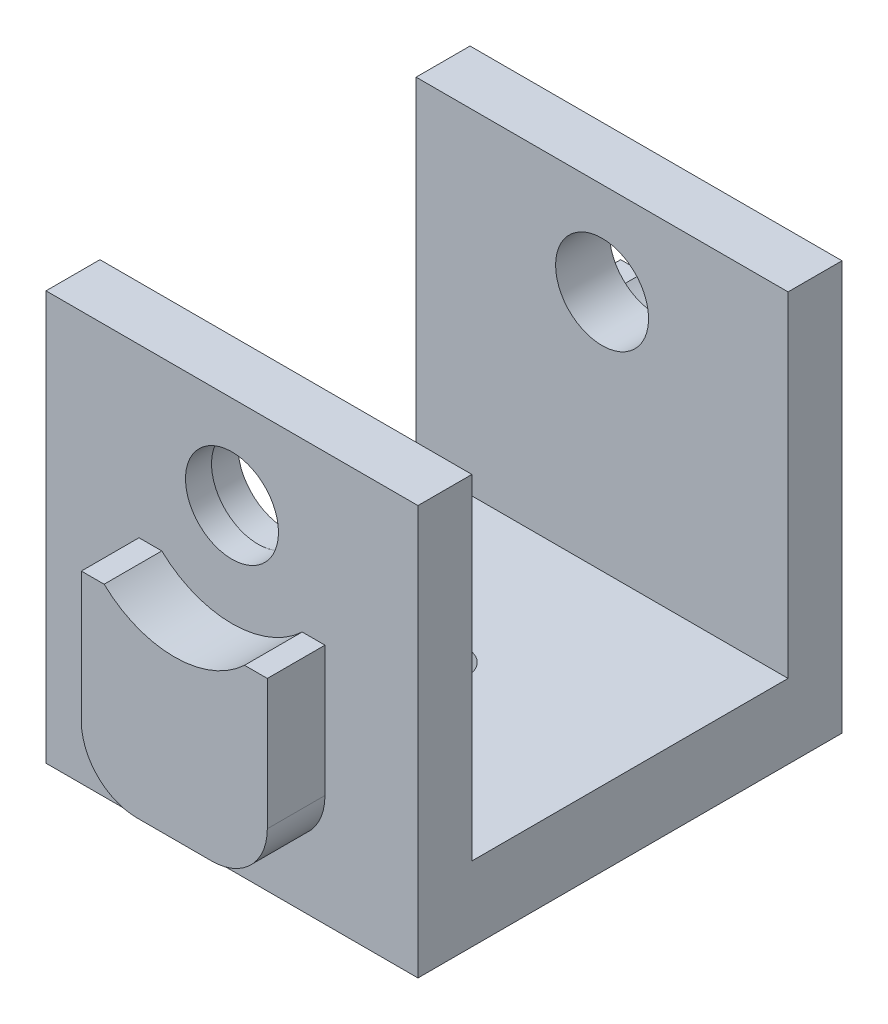
from build123d import *
from build123d.topology import SkipClean

# Parameters (mm, degrees)
SKETCH114_W          = 20
SKETCH114_H          = 22
BOSS_EXTRUDE16_DEPTH = 20
SKETCH115_W          = 17
SKETCH115_H          = 18
CUT_EXTRUDE6_DEPTH   = 48.889560449
BOSS_EXTRUDE17_DEPTH = 3.1
BOSS_EXTRUDE18_DEPTH = 3.1
SKETCH123_W          = 2.5
SKETCH123_H          = 1.501
SKETCH125_W          = 1.2645
SKETCH125_H          = 4
FILLET6_R            = 3
FILLET7_R            = 3
SKETCH128_W          = 2.55
SKETCH128_H          = 4.6
BOSS_EXTRUDE19_START = 1.4
SKETCH130_W          = 20
SKETCH130_H          = 22
SKETCH130_R          = 2.5
BOSS_EXTRUDE19_DEPTH = 1.4
SKETCH131_W          = 20
SKETCH131_H          = 22
SKETCH131_R          = 2.5
BOSS_EXTRUDE20_DEPTH = 1.4
BOSS_EXTRUDE21_DEPTH = 1.4
BOSS_EXTRUDE22_START = 1.4
BOSS_EXTRUDE22_DEPTH = 1.4
CUT_EXTRUDE7_DEPTH   = 2


with BuildPart() as part:
    # Sketch114 → Boss-Extrude16 (new body)
    with BuildSketch(Plane(origin=(20.1, 0, 0), x_dir=(0, 0, -1), z_dir=(1, 0, 0))):
        with Locations((-12.9, 26)):
            Rectangle(SKETCH114_W, SKETCH114_H)
    extrude(amount=-BOSS_EXTRUDE16_DEPTH)

    # Sketch115 → Cut-Extrude6 (cut, through all)
    with BuildSketch(Plane.ZY.offset(-0.1)):
        with Locations((12.9, 28)):
            Rectangle(SKETCH115_W, SKETCH115_H)
    extrude(amount=-CUT_EXTRUDE6_DEPTH, mode=Mode.SUBTRACT)

    # Sketch122 → Boss-Extrude18 (add)
    with BuildSketch(Plane(origin=(0, 0, 2.9), x_dir=(-1, 0, 0), z_dir=(0, 0, -1))):
        with BuildLine():
            Line((-15.1, 18), (-15.1, 28))
            Line((-15.1, 28), (-13.874917218, 28))
            ThreePointArc((-13.874917218, 28), (-10.1, 26.5), (-6.325082782, 28))
            Line((-6.325082782, 28), (-5.1, 28))
            Line((-5.1, 28), (-5.1, 18))
            Line((-5.1, 18), (-15.1, 18))
        make_face()
    extrude(amount=BOSS_EXTRUDE18_DEPTH)

    # Sketch123 → Ø5.0 (5) Diameter Hole1 (revolve, cut)
    with BuildSketch(Plane(origin=(10.1, 32, 2.9), x_dir=(0, 1, 0), z_dir=(1, 0, 0))):
        with Locations((1.25, 0.7505)):
            Rectangle(SKETCH123_W, SKETCH123_H)
    revolve(axis=Axis((10.1, 32, -3.45), (0, 0, 1)), mode=Mode.SUBTRACT)

    # Sketch125 → Ø1.0mm Dowel Hole1 (revolve, cut)
    with BuildSketch(Plane(origin=(10.1, 15, 12.9), x_dir=(0, 0, -1), z_dir=(1, 0, 0))):
        with Locations((0.63225, 2)):
            Rectangle(SKETCH125_W, SKETCH125_H)
    revolve(axis=Axis((10.1, 8.65, 12.9), (0, 1, 0)), mode=Mode.SUBTRACT)

    # Fillet7
    fillet7_edges = [part.edges().sort_by_distance(p)[0] for p in [
        (5.1, 18, 1.35),
        (15.1, 18, 1.35),
    ]]
    fillet(fillet7_edges, radius=FILLET7_R)

    # Sketch128 → Ø5.1 (5.1) Diameter Hole1 (revolve, cut)
    with BuildSketch(Plane(origin=(10.069319505, 31.99803671, 21.4), x_dir=(0, 1, 0), z_dir=(1, 0, 0))):
        with Locations((1.275, 2.3)):
            Rectangle(SKETCH128_W, SKETCH128_H)
    revolve(axis=Axis((10.069319505, 31.99803671, 15.05), (0, 0, 1)), mode=Mode.SUBTRACT)

    # Sketch130 → Boss-Extrude19 (add)
    with SkipClean():  # the faces are left unmerged after this step: merging them gives an invalid solid
        with BuildSketch(Plane(origin=(0, 0, 2.9), x_dir=(-1, 0, 0), z_dir=(0, 0, -1)).offset(BOSS_EXTRUDE19_START)):
            with Locations((-10.1, 26)):
                Rectangle(SKETCH130_W, SKETCH130_H)
            with Locations((-10.1, 32)):
                Circle(SKETCH130_R, mode=Mode.SUBTRACT)
        extrude(amount=-BOSS_EXTRUDE19_DEPTH)



with BuildPart() as body_2:
    # Sketch121 → Boss-Extrude17 (new body)
    with BuildSketch(Plane.XY.offset(22.9)):
        with BuildLine():
            Line((5.1, 28), (6.325082782, 28))
            ThreePointArc((6.325082782, 28), (10.1, 26.5), (13.874917218, 28))
            Line((13.874917218, 28), (15.1, 28))
            Line((15.1, 28), (15.1, 18))
            Line((15.1, 18), (5.1, 18))
            Line((5.1, 18), (5.1, 28))
        make_face()
    extrude(amount=BOSS_EXTRUDE17_DEPTH)

    # Fillet6
    fillet6_edges = [body_2.edges().sort_by_distance(p)[0] for p in [
        (15.1, 18, 24.45),
        (5.1, 18, 24.45),
    ]]
    fillet(fillet6_edges, radius=FILLET6_R)


with BuildPart() as part_1:
    with SkipClean():  # the faces are left unmerged after this step: merging them gives an invalid solid
        add(part.part)

        add(body_2.part)  # Boss-Extrude20 merges body 2
        # Sketch131 → Boss-Extrude20 (add)
        with BuildSketch(Plane.XY.offset(22.9)):
            with Locations((10.1, 26)):
                Rectangle(SKETCH131_W, SKETCH131_H)
            with Locations((10.1, 32)):
                Circle(SKETCH131_R, mode=Mode.SUBTRACT)
        extrude(amount=BOSS_EXTRUDE20_DEPTH)

    # Sketch132 → Boss-Extrude21 (add)
    with SkipClean():  # the faces are left unmerged after this step: merging them gives an invalid solid
        with BuildSketch(Plane.XY.offset(26)):
            with BuildLine():
                Line((8.1, 18), (12.1, 18))
                ThreePointArc((12.1, 18), (14.221320344, 18.878679656), (15.1, 21))
                Line((15.1, 21), (15.1, 28))
                Line((15.1, 28), (13.874917218, 28))
                ThreePointArc((13.874917218, 28), (10.1, 26.5), (6.325082782, 28))
                Line((6.325082782, 28), (5.1, 28))
                Line((5.1, 28), (5.1, 21))
                ThreePointArc((5.1, 21), (5.978679656, 18.878679656), (8.1, 18))
            make_face()
        extrude(amount=BOSS_EXTRUDE21_DEPTH)

    # Sketch133 → Boss-Extrude22 (add)
    with SkipClean():  # the faces are left unmerged after this step: merging them gives an invalid solid
        with BuildSketch(Plane(origin=(0, 0, -0.2), x_dir=(-1, 0, 0), z_dir=(0, 0, -1)).offset(BOSS_EXTRUDE22_START)):
            with BuildLine():
                Line((-12.1, 18), (-8.1, 18))
                ThreePointArc((-8.1, 18), (-5.978679656, 18.878679656), (-5.1, 21))
                Line((-5.1, 21), (-5.1, 28))
                Line((-5.1, 28), (-6.325082782, 28))
                ThreePointArc((-6.325082782, 28), (-10.1, 26.5), (-13.874917218, 28))
                Line((-13.874917218, 28), (-15.1, 28))
                Line((-15.1, 28), (-15.1, 21))
                ThreePointArc((-15.1, 21), (-14.221320344, 18.878679656), (-12.1, 18))
            make_face()
        extrude(amount=-BOSS_EXTRUDE22_DEPTH)

    # Sketch134 → Cut-Extrude7 (cut)
    with SkipClean():  # the faces are left unmerged after this step: merging them gives an invalid solid
        with BuildSketch(Plane.XZ.offset(-15)):
            Polygon((9.565480871, 16.030115435), (8.343730912, 15.016133004), (7.121980952, 14.002150573), (7.389240517, 12.437092855), (7.656500081, 10.872035138), (9.145509605, 10.320959852), (10.634519129, 9.769884565), (11.856269088, 10.783866996), (13.078019048, 11.797849427), (12.810759483, 13.362907145), (12.543499919, 14.927964862), (11.054490395, 15.479040148), align=None)
        extrude(amount=-CUT_EXTRUDE7_DEPTH, mode=Mode.SUBTRACT)


solid = part_1.part
